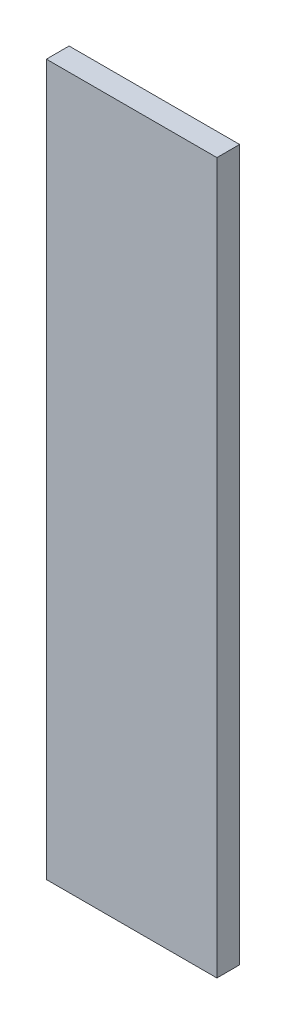
from build123d import *

# Parameters (mm, degrees)
CROQUIS1_W              = 60
CROQUIS1_H              = 250
SALIENTE_EXTRUIR1_DEPTH = 8


with BuildPart() as part:
    # Croquis1 → Saliente-Extruir1 (new body)
    with BuildSketch(Plane.XY):
        with Locations((30, 125)):
            Rectangle(CROQUIS1_W, CROQUIS1_H)
    extrude(amount=SALIENTE_EXTRUIR1_DEPTH)


solid = part.part
